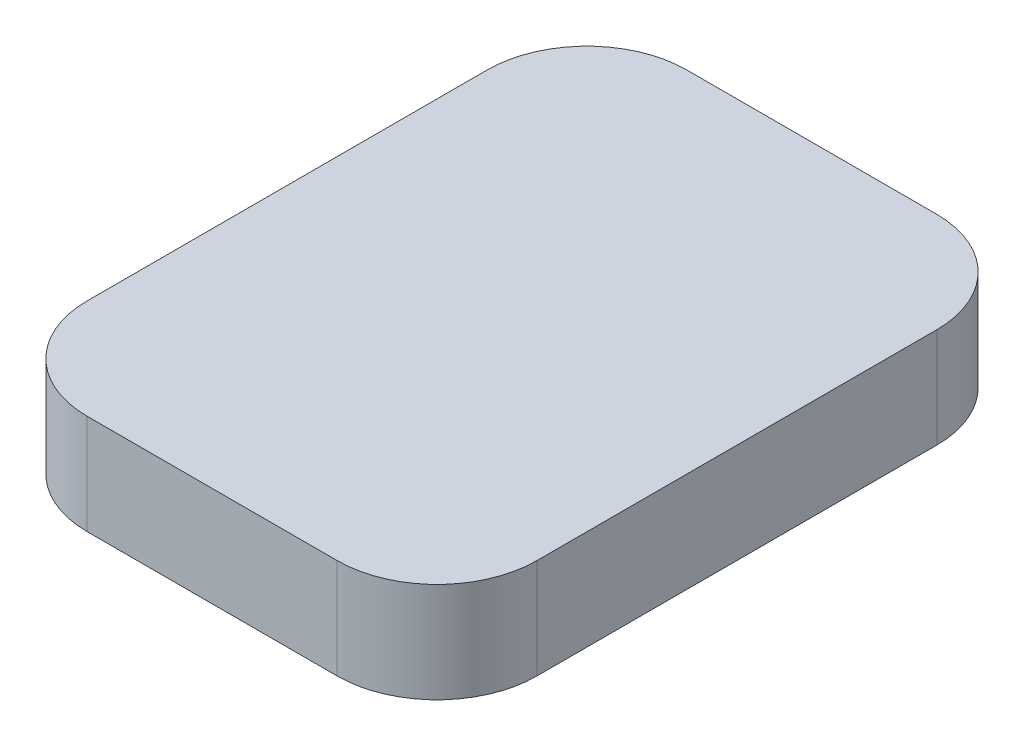
from build123d import *

# Parameters (mm, degrees)
BOSS_EXTRU_1_DEPTH = 10


with BuildPart() as part:
    # Esquisse2 → Boss.-Extru.1 (new body)
    with BuildSketch(Plane(origin=(0, 0, 0), x_dir=(1, 0, 0), z_dir=(0, 1, 0))):
        with BuildLine():
            Line((-12.5, 30), (12.5, 30))
            ThreePointArc((12.5, 30), (19.571067812, 27.071067812), (22.5, 20))
            Line((22.5, 20), (22.5, -20))
            ThreePointArc((22.5, -20), (19.571067812, -27.071067812), (12.5, -30))
            Line((12.5, -30), (-12.5, -30))
            ThreePointArc((-12.5, -30), (-19.571067812, -27.071067812), (-22.5, -20))
            Line((-22.5, -20), (-22.5, 20))
            ThreePointArc((-22.5, 20), (-19.571067812, 27.071067812), (-12.5, 30))
        make_face()
    extrude(amount=BOSS_EXTRU_1_DEPTH)


solid = part.part
